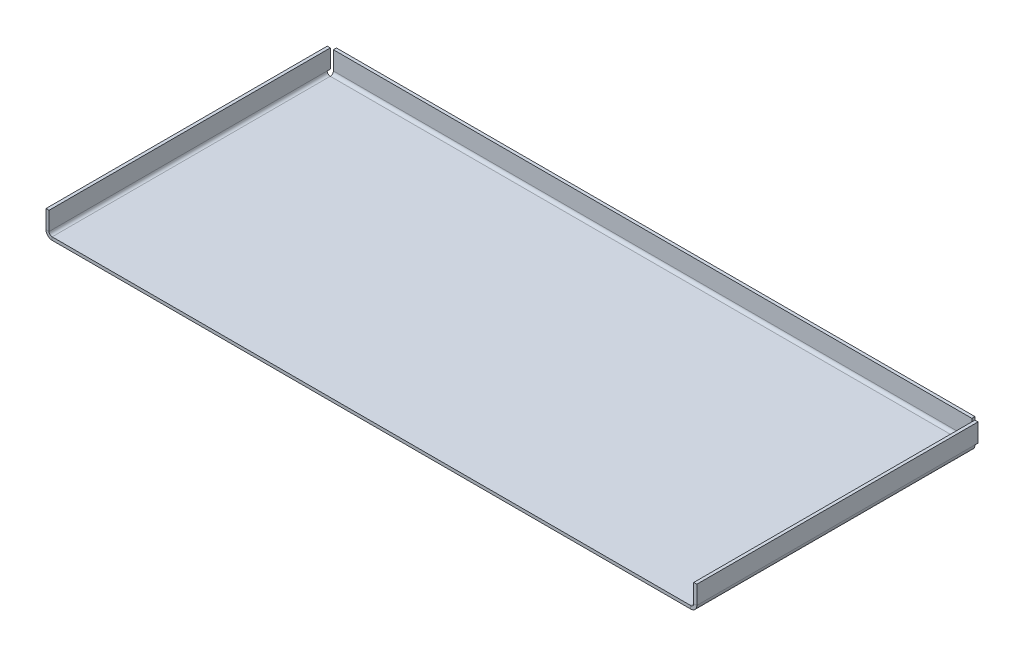
from build123d import *

# Parameters (mm, degrees)
SKETCH1_W                      = 673.11016
SKETCH1_H                      = 290.83
BASE_FLANGE1_DEPTH             = 3.175
EDGE_FLANGE2_STRIP_W           = 19.05
EDGE_FLANGE2_STRIP_H           = 3.175
EDGE_FLANGE2_STRIP_CUT_DEPTH   = 290.83
EDGE_FLANGE2_STRIP_2_W         = 19.05
EDGE_FLANGE2_STRIP_2_H         = 3.175
EDGE_FLANGE2_STRIP_CUT_2_DEPTH = 290.83
EDGE_FLANGE2_DEPTH             = 290.83
EDGE_FLANGE2_BEND_DEPTH        = 290.83
EDGE_FLANGE3_DEPTH             = 673.11016
EDGE_FLANGE3_2_DEPTH           = 6.35
EDGE_FLANGE3_START             = 666.76016
EDGE_FLANGE3_3_DEPTH           = 6.35
EDGE_FLANGE3_START_2           = 6.35
EDGE_FLANGE3_4_DEPTH           = 660.41016


# Read off the part's stored shape, not the designer's step: Edge-Flange3
# Sheet-metal steps are written as plain solids
with BuildPart() as part:
    # Sketch1 → Base-Flange1 (new body)
    with BuildSketch(Plane(origin=(0, 0, 0), x_dir=(1, 0, 0), z_dir=(0, 1, 0))):
        with Locations((336.55508, 145.415)):
            Rectangle(SKETCH1_W, SKETCH1_H)
    extrude(amount=-BASE_FLANGE1_DEPTH)

    # Edge-Flange2 strip (across the edge) → Edge-Flange2 strip cut (cut)
    with BuildSketch(Plane(origin=(673.11016, 0, 0), x_dir=(-1, 0, 0), z_dir=(0, 0, -1))):
        with Locations((-3.175, -1.5875)):
            Rectangle(EDGE_FLANGE2_STRIP_W, EDGE_FLANGE2_STRIP_H)
    extrude(amount=EDGE_FLANGE2_STRIP_CUT_DEPTH, mode=Mode.SUBTRACT)

    # Edge-Flange2 strip 2 (across the edge) → Edge-Flange2 strip cut 2 (cut)
    with BuildSketch(Plane.XY.offset(-290.83)):
        with Locations((-3.175, -1.5875)):
            Rectangle(EDGE_FLANGE2_STRIP_2_W, EDGE_FLANGE2_STRIP_2_H)
    extrude(amount=EDGE_FLANGE2_STRIP_CUT_2_DEPTH, mode=Mode.SUBTRACT)

    # Edge-Flange2 section (across the edge) → Edge-Flange2 (add)
    with BuildSketch(Plane(origin=(673.11016, 0, 0), x_dir=(-1, 0, 0), z_dir=(0, 0, -1))):
        with BuildLine():
            Line((0, 3.175), (0, 22.225))
            Line((0, 22.225), (3.175, 22.225))
            Line((3.175, 22.225), (3.175, 3.175))
            ThreePointArc((3.175, 3.175), (4.10493597, 0.92993597), (6.35, 0))
            Line((6.35, 0), (6.35, -3.175))
            ThreePointArc((6.35, -3.175), (1.859871939, -1.315128061), (0, 3.175))
        make_face()
    extrude(amount=EDGE_FLANGE2_DEPTH)

    # Edge-Flange2 section 2 (across the edge) → Edge-Flange2 bend (add)
    with BuildSketch(Plane.XY.offset(-290.83)):
        with BuildLine():
            Line((0, 3.175), (0, 22.225))
            Line((0, 22.225), (3.175, 22.225))
            Line((3.175, 22.225), (3.175, 3.175))
            ThreePointArc((3.175, 3.175), (4.10493597, 0.92993597), (6.35, 0))
            Line((6.35, 0), (6.35, -3.175))
            ThreePointArc((6.35, -3.175), (1.859871939, -1.315128061), (0, 3.175))
        make_face()
    extrude(amount=EDGE_FLANGE2_BEND_DEPTH)

    # Edge-Flange3 outline → Edge-Flange3 (cut)
    with BuildSketch(Plane.YZ):
        with BuildLine():
            Line((3.175, -290.83), (3.175, -287.655))
            Line((3.175, -287.655), (0, -287.655))
            ThreePointArc((0, -287.655), (0.92993597, -289.90006403), (3.175, -290.83))
        make_face()
        with BuildLine():
            ThreePointArc((-2.324261315, -290.83), (-2.958628997, -289.298500936), (-3.175, -287.655))
            Line((-3.175, -287.655), (-3.175, -290.83))
            Line((-3.175, -290.83), (-2.324261315, -290.83))
        make_face()
    extrude(amount=EDGE_FLANGE3_DEPTH, mode=Mode.SUBTRACT)

    # Edge-Flange3 2 outline → Edge-Flange3 2 (cut)
    with BuildSketch(Plane.YZ):
        with BuildLine():
            ThreePointArc((3.175, -290.83), (0.92993597, -289.90006403), (0, -287.655))
            Line((0, -287.655), (-3.175, -287.655))
            ThreePointArc((-3.175, -287.655), (-2.958628997, -289.298500936), (-2.324261315, -290.83))
            Line((-2.324261315, -290.83), (3.175, -290.83))
        make_face()
    extrude(amount=EDGE_FLANGE3_2_DEPTH, mode=Mode.SUBTRACT)

    # Edge-Flange3 3 outline → Edge-Flange3 3 (cut)
    with BuildSketch(Plane.YZ.offset(EDGE_FLANGE3_START)):
        with BuildLine():
            ThreePointArc((3.175, -290.83), (0.92993597, -289.90006403), (0, -287.655))
            Line((0, -287.655), (-3.175, -287.655))
            ThreePointArc((-3.175, -287.655), (-2.958628997, -289.298500936), (-2.324261315, -290.83))
            Line((-2.324261315, -290.83), (3.175, -290.83))
        make_face()
    extrude(amount=EDGE_FLANGE3_3_DEPTH, mode=Mode.SUBTRACT)

    # Edge-Flange3 4 outline → Edge-Flange3 4 (add)
    with BuildSketch(Plane.YZ.offset(EDGE_FLANGE3_START_2)):
        with BuildLine():
            Line((0, -287.655), (0, -290.83))
            Line((0, -290.83), (-2.324261315, -290.83))
            ThreePointArc((-2.324261315, -290.83), (-1e-09, -293.154261314), (3.175, -294.005))
            Line((3.175, -294.005), (22.225, -294.005))
            Line((22.225, -294.005), (22.225, -290.83))
            Line((22.225, -290.83), (3.175, -290.83))
            ThreePointArc((3.175, -290.83), (0.92993597, -289.90006403), (0, -287.655))
        make_face()
    extrude(amount=EDGE_FLANGE3_4_DEPTH)


solid = part.part
